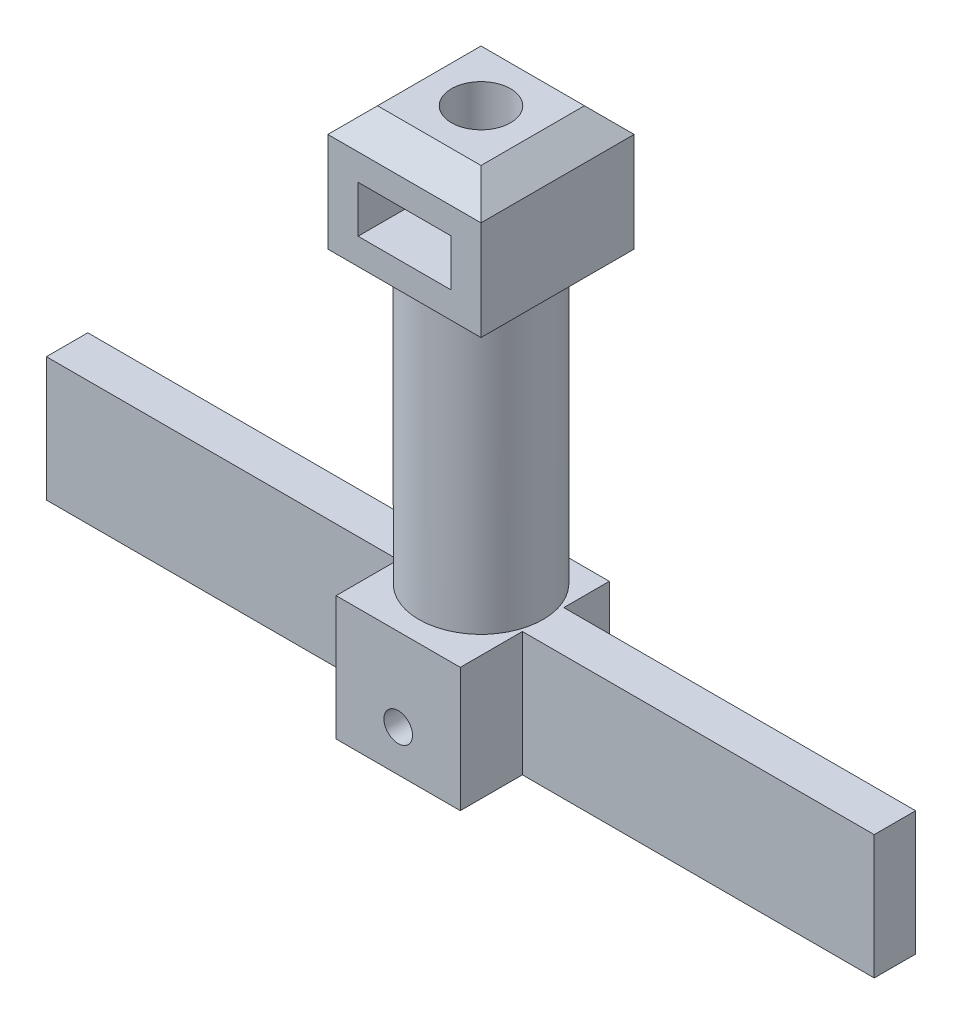
from build123d import *

# Parameters (mm, degrees)
SKETCH1_W                   = 100
SKETCH1_H                   = 10
BOSS_EXTRUDE1_DEPTH         = 15
SKETCH2_R                   = 7.5
BOSS_EXTRUDE2_DEPTH         = 30
SKETCH3_W                   = 18.5
SKETCH3_H                   = 18.5
BOSS_EXTRUDE3_DEPTH         = 20
CHAMFER1_SIZE               = 3
CHAMFER2_SIZE               = 5
SKETCH4_W                   = 11.2
SKETCH4_H                   = 5.65
CUT_EXTRUDE1_DEPTH          = 121.694863188
F_1_4_CLEARANCE_HOLE1_D     = 7.14248
F_1_4_CLEARANCE_HOLE1_DEPTH = 25
F_1_4_CLEARANCE_HOLE1_TIP   = 2.145817477
SKETCH8_W                   = 15
SKETCH8_H                   = 15
BOSS_EXTRUDE4_DEPTH         = 5
SKETCH9_R                   = 2.65
CUT_EXTRUDE2_DEPTH          = 25
F_4_CLEARANCE_HOLE1_D       = 3.4544
F_4_CLEARANCE_HOLE1_DEPTH   = 10
F_4_CLEARANCE_HOLE1_TIP     = 1.037806461
SKETCH13_W                  = 6.6
SKETCH13_H                  = 2.79
CUT_EXTRUDE3_DEPTH          = 7.7559
SKETCH14_W                  = 15
SKETCH14_H                  = 15
BOSS_EXTRUDE5_DEPTH         = 3
SKETCH15_W                  = 2.5
SKETCH15_H                  = 15
CUT_EXTRUDE4_DEPTH          = 42.5
SKETCH16_W                  = 2.5
SKETCH16_H                  = 15
CUT_EXTRUDE5_DEPTH          = 42.5


with BuildPart() as part:
    # Sketch1 → Boss-Extrude1 (new body)
    with BuildSketch(Plane(origin=(0, 0, 0), x_dir=(1, 0, 0), z_dir=(0, 1, 0))):
        with Locations((50, 5)):
            Rectangle(SKETCH1_W, SKETCH1_H)
    extrude(amount=BOSS_EXTRUDE1_DEPTH)

    # Sketch2 → Boss-Extrude2 (add)
    with BuildSketch(Plane(origin=(0, 15, 0), x_dir=(1, 0, 0), z_dir=(0, 1, 0))):
        with Locations(Location((50, 5, 0), (0, 0, 41.810314896))):
            Circle(SKETCH2_R)
    extrude(amount=BOSS_EXTRUDE2_DEPTH)

    # Sketch3 → Boss-Extrude3 (add)
    with BuildSketch(Plane(origin=(0, 45, 0), x_dir=(1, 0, 0), z_dir=(0, 1, 0))):
        with Locations((50, 5)):
            Rectangle(SKETCH3_W, SKETCH3_H)
    extrude(amount=BOSS_EXTRUDE3_DEPTH)

    # Chamfer1
    chamfer1_edges = [part.edges().sort_by_distance(p)[0] for p in [
        (40.75, 65, -5),
        (50, 65, 4.25),
        (59.25, 65, -5),
        (50, 65, -14.25),
    ]]
    chamfer(chamfer1_edges, length=CHAMFER1_SIZE)

    # Chamfer2
    # the kernel refuses this chamfer: 5 mm, written as the material it takes off along each edge
    with BuildSketch(Plane(origin=(27.89158506, 45, -14.25), x_dir=(0, 0.9996219169112968, -0.027495876610586317), z_dir=(1, 0, 0))) as chamfer2_piece_1_section:
        Polygon((CHAMFER2_SIZE * 0.999621916911, CHAMFER2_SIZE * 0.0274958766106), (-CHAMFER2_SIZE * 0.0274958766106, CHAMFER2_SIZE * 0.999621916911), (0, 0), align=None)
    chamfer2_piece_1 = extrude(amount=44.21682988, mode=Mode.PRIVATE)
    chamfer2_piece_1 = chamfer2_piece_1 - Plane(origin=(50, 46.70985324, -5), x_dir=(0.7453559924973537, 0, -0.6666666666695469), z_dir=(0, -1, 0)) * Cylinder(7.5, 109, mode=Mode.PRIVATE)
    with BuildSketch(Plane(origin=(40.75, 45, 17.10841494), x_dir=(-0.027495876610586317, 0.9996219169112968, 0), z_dir=(0, 0, -1))) as chamfer2_piece_2_section:
        Polygon((CHAMFER2_SIZE * 0.999621916911, CHAMFER2_SIZE * 0.0274958766106), (-CHAMFER2_SIZE * 0.0274958766106, CHAMFER2_SIZE * 0.999621916911), (0, 0), align=None)
    chamfer2_piece_2 = extrude(amount=44.21682988, mode=Mode.PRIVATE)
    chamfer2_piece_2 = chamfer2_piece_2 - Plane(origin=(50, 46.709853278, -5), x_dir=(0.7453559924973537, 0, -0.6666666666695469), z_dir=(0, -1, 0)) * Cylinder(7.5, 109, mode=Mode.PRIVATE)
    with BuildSketch(Plane(origin=(59.25, 45, -27.10841494), x_dir=(-0.9996219169112968, -0.027495876610586317, 0), z_dir=(0, 0, 1))) as chamfer2_piece_3_section:
        Polygon((CHAMFER2_SIZE * 0.999621916911, -CHAMFER2_SIZE * 0.0274958766106), (-CHAMFER2_SIZE * 0.0274958766106, -CHAMFER2_SIZE * 0.999621916911), (0, 0), align=None)
    chamfer2_piece_3 = extrude(amount=44.21682988, mode=Mode.PRIVATE)
    chamfer2_piece_3 = chamfer2_piece_3 - Plane(origin=(50, 46.709853248, -5), x_dir=(0.7453559924973537, 0, -0.6666666666695469), z_dir=(0, -1, 0)) * Cylinder(7.5, 109, mode=Mode.PRIVATE)
    with BuildSketch(Plane(origin=(72.10841494, 45, 4.25), x_dir=(0, -0.027495876610586317, -0.9996219169112968), z_dir=(-1, 0, 0))) as chamfer2_piece_4_section:
        Polygon((CHAMFER2_SIZE * 0.999621916911, -CHAMFER2_SIZE * 0.0274958766106), (-CHAMFER2_SIZE * 0.0274958766106, -CHAMFER2_SIZE * 0.999621916911), (0, 0), align=None)
    chamfer2_piece_4 = extrude(amount=44.21682988, mode=Mode.PRIVATE)
    chamfer2_piece_4 = chamfer2_piece_4 - Plane(origin=(50, 46.709853226, -5), x_dir=(0.7453559924973537, 0, -0.6666666666695469), z_dir=(0, -1, 0)) * Cylinder(7.5, 109, mode=Mode.PRIVATE)
    add([chamfer2_piece_1, chamfer2_piece_2, chamfer2_piece_3, chamfer2_piece_4], mode=Mode.SUBTRACT)

    # Sketch4 → Cut-Extrude1 (cut, through all)
    with BuildSketch(Plane.XY.offset(4.25)):
        with Locations((50, 56)):
            Rectangle(SKETCH4_W, SKETCH4_H)
    extrude(amount=-CUT_EXTRUDE1_DEPTH, mode=Mode.SUBTRACT)

    # 1/4 Clearance Hole1
    with Locations(Plane(origin=(0, 65, 0), x_dir=(1, 0, 0), z_dir=(0, 1, 0))):
        with Locations((50, 5)):
            Hole(F_1_4_CLEARANCE_HOLE1_D / 2, depth=F_1_4_CLEARANCE_HOLE1_DEPTH)
            with Locations((0, 0, -(F_1_4_CLEARANCE_HOLE1_DEPTH + F_1_4_CLEARANCE_HOLE1_TIP / 2))):  # 118° drill point
                Cone(0, F_1_4_CLEARANCE_HOLE1_D / 2, F_1_4_CLEARANCE_HOLE1_TIP, mode=Mode.SUBTRACT)

    # Sketch8 → Boss-Extrude4 (add)
    with BuildSketch(Plane.XY):
        with Locations((50, 7.5)):
            Rectangle(SKETCH8_W, SKETCH8_H)
    extrude(amount=BOSS_EXTRUDE4_DEPTH)

    # Sketch9 → Cut-Extrude2 (cut)
    with BuildSketch(Plane.XZ):
        with Locations(Location((50, -5, 0), (0, 0, 270))):
            Circle(SKETCH9_R)
    extrude(amount=-CUT_EXTRUDE2_DEPTH, mode=Mode.SUBTRACT)

    # #4 Clearance Hole1
    with Locations(Plane.XY.offset(5)):
        with Locations((50, 5)):
            Hole(F_4_CLEARANCE_HOLE1_D / 2, depth=F_4_CLEARANCE_HOLE1_DEPTH)
            with Locations((0, 0, -(F_4_CLEARANCE_HOLE1_DEPTH + F_4_CLEARANCE_HOLE1_TIP / 2))):  # 118° drill point
                Cone(0, F_4_CLEARANCE_HOLE1_D / 2, F_4_CLEARANCE_HOLE1_TIP, mode=Mode.SUBTRACT)

    # Sketch13 → Cut-Extrude3 (cut)
    with BuildSketch(Plane.XZ):
        with Locations((50, 1.105)):
            Rectangle(SKETCH13_W, SKETCH13_H)
    extrude(amount=-CUT_EXTRUDE3_DEPTH, mode=Mode.SUBTRACT)

    # Sketch14 → Boss-Extrude5 (add)
    with BuildSketch(Plane(origin=(0, 0, -10), x_dir=(-1, 0, 0), z_dir=(0, 0, -1))):
        with Locations((-50, 7.5)):
            Rectangle(SKETCH14_W, SKETCH14_H)
    extrude(amount=BOSS_EXTRUDE5_DEPTH)

    # Sketch15 → Cut-Extrude4 (cut)
    with BuildSketch(Plane(origin=(100, 0, 0), x_dir=(0, 0, -1), z_dir=(1, 0, 0))):
        with Locations((1.25, 7.5)):
            Rectangle(SKETCH15_W, SKETCH15_H)
        with Locations((8.75, 7.5)):
            Rectangle(SKETCH15_W, SKETCH15_H)
    extrude(amount=-CUT_EXTRUDE4_DEPTH, mode=Mode.SUBTRACT)

    # Sketch16 → Cut-Extrude5 (cut)
    with BuildSketch(Plane.ZY):
        with Locations((-8.75, 7.5)):
            Rectangle(SKETCH16_W, SKETCH16_H)
        with Locations((-1.25, 7.5)):
            Rectangle(SKETCH16_W, SKETCH16_H)
    extrude(amount=-CUT_EXTRUDE5_DEPTH, mode=Mode.SUBTRACT)


solid = part.part
